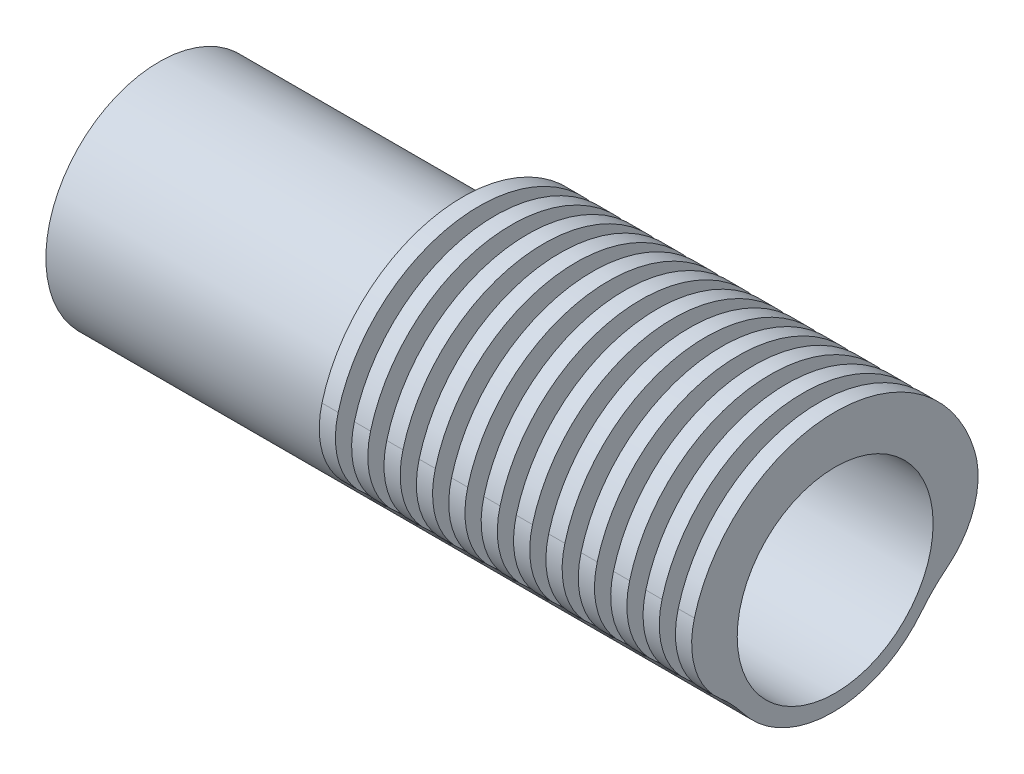
from build123d import *

# Parameters (mm, degrees)
SKETCH1_R           = 7
SKETCH1_R_2         = 4
BOSS_EXTRUDE1_DEPTH = 1.5
SKETCH2_R           = 7
SKETCH2_R_2         = 6.4
BOSS_EXTRUDE2_DEPTH = 40.1
BOSS_EXTRUDE5_REACH = 44.786
SKETCH12_R          = 6.4
SKETCH12_R_2        = 6.05
BOSS_EXTRUDE7_START = -1
BOSS_EXTRUDE7_DEPTH = 1
FILLET2_R           = 10
FILLET3_R           = 5
LPATTERN1_START     = 18.6
LPATTERN1_DEPTH     = 1
LPATTERN1_START_2   = 20.6
LPATTERN1_2_DEPTH   = 1
LPATTERN1_START_3   = 22.6
LPATTERN1_3_DEPTH   = 1
LPATTERN1_START_4   = 24.6
LPATTERN1_4_DEPTH   = 1
LPATTERN1_START_5   = 26.6
LPATTERN1_5_DEPTH   = 1
LPATTERN1_START_6   = 28.6
LPATTERN1_6_DEPTH   = 1
LPATTERN1_START_7   = 30.6
LPATTERN1_7_DEPTH   = 1
LPATTERN1_START_8   = 32.6
LPATTERN1_8_DEPTH   = 1
LPATTERN1_START_9   = 34.6
LPATTERN1_9_DEPTH   = 1
LPATTERN1_START_10  = 36.6
LPATTERN1_10_DEPTH  = 1
LPATTERN1_START_11  = 38.6
LPATTERN1_11_DEPTH  = 1
SKETCH15_R          = 7


# Read off the part's stored shape, not the designer's step: LPattern1
with BuildPart() as part:
    # Sketch1 → Boss-Extrude1 (new body)
    with BuildSketch(Plane(origin=(0, 0, 0), x_dir=(0, 0, -1), z_dir=(1, 0, 0))):
        with Locations((-0.15, 0)):
            Circle(SKETCH1_R)
        Circle(SKETCH1_R_2, mode=Mode.SUBTRACT)
    extrude(amount=BOSS_EXTRUDE1_DEPTH)

    # Sketch2 → Boss-Extrude2 (add)
    with BuildSketch(Plane(origin=(1.5, 0, 0), x_dir=(0, 0, -1), z_dir=(1, 0, 0))):
        with Locations((-0.15, 0)):
            Circle(SKETCH2_R)
        with Locations((-0.15, 0)):
            Circle(SKETCH2_R_2, mode=Mode.SUBTRACT)
    extrude(amount=BOSS_EXTRUDE2_DEPTH)

    # Sketch12 → Boss-Extrude5 (add, up to next)
    with BuildSketch(Plane(origin=(41.6, 0, 0), x_dir=(0, 0, -1), z_dir=(1, 0, 0)), mode=Mode.PRIVATE) as boss_extrude5_sk1:
        with Locations((-0.15, 0)):
            Circle(SKETCH12_R)
        Circle(SKETCH12_R_2, mode=Mode.SUBTRACT)
    boss_extrude5_tool1 = extrude(boss_extrude5_sk1.sketch, amount=-BOSS_EXTRUDE5_REACH, mode=Mode.PRIVATE) - part.part
    add(boss_extrude5_tool1.solids().sort_by_distance((41.6, 0, 6.368981))[0])

    # Sketch14 → Boss-Extrude7 (add)
    with BuildSketch(Plane(origin=(41.6, 0, 0), x_dir=(0, 0, -1), z_dir=(1, 0, 0)).offset(BOSS_EXTRUDE7_START)):
        with BuildLine():
            Line((-7.039083492, -1.241180339), (-8.863269777, -1.562833599))
            ThreePointArc((-8.863269777, -1.562833599), (0, 9), (8.863269777, -1.562833599))
            Line((8.863269777, -1.562833599), (6.748129599, -1.189877318))
            ThreePointArc((6.748129599, -1.189877318), (-0.176047227, 6.999951539), (-7.039083492, -1.241180339))
        make_face()
    extrude(amount=BOSS_EXTRUDE7_DEPTH)

    # Fillet2
    # the kernel refuses this fillet: 10 mm, written as the material it adds along each edge
    with BuildSketch(Plane(origin=(40.6, -1.189877318, -6.748129599), x_dir=(0, -0.9122124275498228, 0.409717569825434), z_dir=(1, 0, 0))) as fillet2_piece_1:
        with BuildLine():
            CenterArc((5.968676638, 9.685818843), FILLET2_R, 229.495547536, 26.104158306)
            Line((-0.526394739, 2.082263897), (-0.656296166, 1.930192799))
            ThreePointArc((-0.656296166, 1.930192799), (-0.457097485, 0.992114146), (-0.193900116, -0.049017803))
            Line((-0.193900116, -0.049017803), (0.049738972, -0.193716377))
            ThreePointArc((0.049738972, -0.193716377), (1.740864019, 0.01992681), (3.431989067, -0.193716377))
            Line((3.431989067, -0.193716377), (3.481728039, 0))
        make_face()
    extrude(amount=1)
    with BuildSketch(Plane(origin=(40.6, -1.241180339, 7.039083492), x_dir=(0, -0.9145376119425217, -0.4045008731047063), z_dir=(1, 0, 0))) as fillet2_piece_2:
        with BuildLine():
            CenterArc((5.662402917, -9.717692138), FILLET2_R, 103.646653122, 23.987142505)
            Line((-0.443720941, -1.798395993), (-0.565843418, -1.64001007))
            ThreePointArc((-0.565843418, -1.64001007), (-0.416037384, -0.851288435), (-0.194176914, 0.047909561))
            Line((-0.194176914, 0.047909561), (0.047186691, 0.194353843))
            ThreePointArc((0.047186691, 0.194353843), (1.651534184, 0.002384497), (3.255881677, 0.194353843))
            Line((3.255881677, 0.194353843), (3.303068368, 0))
        make_face()
    extrude(amount=1)

    # Fillet3
    fillet3_edges = [part.edges().sort_by_distance(p)[0] for p in [
        (41.1, -1.562833599, 8.863269777),
        (41.1, -1.562833599, -8.863269777),
    ]]
    fillet(fillet3_edges, radius=FILLET3_R)

    # LPattern1 outline → LPattern1 (add)
    with BuildSketch(Plane.YZ.offset(LPATTERN1_START)):
        with BuildLine():
            ThreePointArc((-2.762069023, -6.931785952), (-0.336916962, -8.599750686), (2.606424088, -8.614322578))
            ThreePointArc((2.606424088, -8.614322578), (8.998759062, 0.149450112), (2.31893468, 8.696122236))
            ThreePointArc((2.31893468, 8.696122236), (-0.448823677, 8.641049813), (-2.763066821, 7.121905987))
            ThreePointArc((-2.763066821, 7.121905987), (-3.475808056, 6.373673153), (-4.261960597, 5.702989453))
            ThreePointArc((-4.261960597, 5.702989453), (6.999688602, 0.083973644), (-4.365952904, -5.321604449))
            ThreePointArc((-4.365952904, -5.321604449), (-3.518119256, -6.080982981), (-2.762069023, -6.931785952))
        make_face()
    extrude(amount=LPATTERN1_DEPTH)

    # LPattern1 2 outline → LPattern1 2 (add)
    with BuildSketch(Plane.YZ.offset(LPATTERN1_START_2)):
        with BuildLine():
            ThreePointArc((-2.762069023, -6.931785952), (-0.336916962, -8.599750686), (2.606424088, -8.614322578))
            ThreePointArc((2.606424088, -8.614322578), (8.998759062, 0.149450112), (2.31893468, 8.696122236))
            ThreePointArc((2.31893468, 8.696122236), (-0.448823677, 8.641049813), (-2.763066821, 7.121905987))
            ThreePointArc((-2.763066821, 7.121905987), (-3.475808056, 6.373673153), (-4.261960597, 5.702989453))
            ThreePointArc((-4.261960597, 5.702989453), (6.999688602, 0.083973644), (-4.365952904, -5.321604449))
            ThreePointArc((-4.365952904, -5.321604449), (-3.518119256, -6.080982981), (-2.762069023, -6.931785952))
        make_face()
    extrude(amount=LPATTERN1_2_DEPTH)

    # LPattern1 3 outline → LPattern1 3 (add)
    with BuildSketch(Plane.YZ.offset(LPATTERN1_START_3)):
        with BuildLine():
            ThreePointArc((-2.762069023, -6.931785952), (-0.336916962, -8.599750686), (2.606424088, -8.614322578))
            ThreePointArc((2.606424088, -8.614322578), (8.998759062, 0.149450112), (2.31893468, 8.696122236))
            ThreePointArc((2.31893468, 8.696122236), (-0.448823677, 8.641049813), (-2.763066821, 7.121905987))
            ThreePointArc((-2.763066821, 7.121905987), (-3.475808056, 6.373673153), (-4.261960597, 5.702989453))
            ThreePointArc((-4.261960597, 5.702989453), (6.999688602, 0.083973644), (-4.365952904, -5.321604449))
            ThreePointArc((-4.365952904, -5.321604449), (-3.518119256, -6.080982981), (-2.762069023, -6.931785952))
        make_face()
    extrude(amount=LPATTERN1_3_DEPTH)

    # LPattern1 4 outline → LPattern1 4 (add)
    with BuildSketch(Plane.YZ.offset(LPATTERN1_START_4)):
        with BuildLine():
            ThreePointArc((-2.762069023, -6.931785952), (-0.336916962, -8.599750686), (2.606424088, -8.614322578))
            ThreePointArc((2.606424088, -8.614322578), (8.998759062, 0.149450112), (2.31893468, 8.696122236))
            ThreePointArc((2.31893468, 8.696122236), (-0.448823677, 8.641049813), (-2.763066821, 7.121905987))
            ThreePointArc((-2.763066821, 7.121905987), (-3.475808056, 6.373673153), (-4.261960597, 5.702989453))
            ThreePointArc((-4.261960597, 5.702989453), (6.999688602, 0.083973644), (-4.365952904, -5.321604449))
            ThreePointArc((-4.365952904, -5.321604449), (-3.518119256, -6.080982981), (-2.762069023, -6.931785952))
        make_face()
    extrude(amount=LPATTERN1_4_DEPTH)

    # LPattern1 5 outline → LPattern1 5 (add)
    with BuildSketch(Plane.YZ.offset(LPATTERN1_START_5)):
        with BuildLine():
            ThreePointArc((-2.762069023, -6.931785952), (-0.336916962, -8.599750686), (2.606424088, -8.614322578))
            ThreePointArc((2.606424088, -8.614322578), (8.998759062, 0.149450112), (2.31893468, 8.696122236))
            ThreePointArc((2.31893468, 8.696122236), (-0.448823677, 8.641049813), (-2.763066821, 7.121905987))
            ThreePointArc((-2.763066821, 7.121905987), (-3.475808056, 6.373673153), (-4.261960597, 5.702989453))
            ThreePointArc((-4.261960597, 5.702989453), (6.999688602, 0.083973644), (-4.365952904, -5.321604449))
            ThreePointArc((-4.365952904, -5.321604449), (-3.518119256, -6.080982981), (-2.762069023, -6.931785952))
        make_face()
    extrude(amount=LPATTERN1_5_DEPTH)

    # LPattern1 6 outline → LPattern1 6 (add)
    with BuildSketch(Plane.YZ.offset(LPATTERN1_START_6)):
        with BuildLine():
            ThreePointArc((-2.762069023, -6.931785952), (-0.336916962, -8.599750686), (2.606424088, -8.614322578))
            ThreePointArc((2.606424088, -8.614322578), (8.998759062, 0.149450112), (2.31893468, 8.696122236))
            ThreePointArc((2.31893468, 8.696122236), (-0.448823677, 8.641049813), (-2.763066821, 7.121905987))
            ThreePointArc((-2.763066821, 7.121905987), (-3.475808056, 6.373673153), (-4.261960597, 5.702989453))
            ThreePointArc((-4.261960597, 5.702989453), (6.999688602, 0.083973644), (-4.365952904, -5.321604449))
            ThreePointArc((-4.365952904, -5.321604449), (-3.518119256, -6.080982981), (-2.762069023, -6.931785952))
        make_face()
    extrude(amount=LPATTERN1_6_DEPTH)

    # LPattern1 7 outline → LPattern1 7 (add)
    with BuildSketch(Plane.YZ.offset(LPATTERN1_START_7)):
        with BuildLine():
            ThreePointArc((-2.762069023, -6.931785952), (-0.336916962, -8.599750686), (2.606424088, -8.614322578))
            ThreePointArc((2.606424088, -8.614322578), (8.998759062, 0.149450112), (2.31893468, 8.696122236))
            ThreePointArc((2.31893468, 8.696122236), (-0.448823677, 8.641049813), (-2.763066821, 7.121905987))
            ThreePointArc((-2.763066821, 7.121905987), (-3.475808056, 6.373673153), (-4.261960597, 5.702989453))
            ThreePointArc((-4.261960597, 5.702989453), (6.999688602, 0.083973644), (-4.365952904, -5.321604449))
            ThreePointArc((-4.365952904, -5.321604449), (-3.518119256, -6.080982981), (-2.762069023, -6.931785952))
        make_face()
    extrude(amount=LPATTERN1_7_DEPTH)

    # LPattern1 8 outline → LPattern1 8 (add)
    with BuildSketch(Plane.YZ.offset(LPATTERN1_START_8)):
        with BuildLine():
            ThreePointArc((-2.762069023, -6.931785952), (-0.336916962, -8.599750686), (2.606424088, -8.614322578))
            ThreePointArc((2.606424088, -8.614322578), (8.998759062, 0.149450112), (2.31893468, 8.696122236))
            ThreePointArc((2.31893468, 8.696122236), (-0.448823677, 8.641049813), (-2.763066821, 7.121905987))
            ThreePointArc((-2.763066821, 7.121905987), (-3.475808056, 6.373673153), (-4.261960597, 5.702989453))
            ThreePointArc((-4.261960597, 5.702989453), (6.999688602, 0.083973644), (-4.365952904, -5.321604449))
            ThreePointArc((-4.365952904, -5.321604449), (-3.518119256, -6.080982981), (-2.762069023, -6.931785952))
        make_face()
    extrude(amount=LPATTERN1_8_DEPTH)

    # LPattern1 9 outline → LPattern1 9 (add)
    with BuildSketch(Plane.YZ.offset(LPATTERN1_START_9)):
        with BuildLine():
            ThreePointArc((-2.762069023, -6.931785952), (-0.336916962, -8.599750686), (2.606424088, -8.614322578))
            ThreePointArc((2.606424088, -8.614322578), (8.998759062, 0.149450112), (2.31893468, 8.696122236))
            ThreePointArc((2.31893468, 8.696122236), (-0.448823677, 8.641049813), (-2.763066821, 7.121905987))
            ThreePointArc((-2.763066821, 7.121905987), (-3.475808056, 6.373673153), (-4.261960597, 5.702989453))
            ThreePointArc((-4.261960597, 5.702989453), (6.999688602, 0.083973644), (-4.365952904, -5.321604449))
            ThreePointArc((-4.365952904, -5.321604449), (-3.518119256, -6.080982981), (-2.762069023, -6.931785952))
        make_face()
    extrude(amount=LPATTERN1_9_DEPTH)

    # LPattern1 10 outline → LPattern1 10 (add)
    with BuildSketch(Plane.YZ.offset(LPATTERN1_START_10)):
        with BuildLine():
            ThreePointArc((-2.762069023, -6.931785952), (-0.336916962, -8.599750686), (2.606424088, -8.614322578))
            ThreePointArc((2.606424088, -8.614322578), (8.998759062, 0.149450112), (2.31893468, 8.696122236))
            ThreePointArc((2.31893468, 8.696122236), (-0.448823677, 8.641049813), (-2.763066821, 7.121905987))
            ThreePointArc((-2.763066821, 7.121905987), (-3.475808056, 6.373673153), (-4.261960597, 5.702989453))
            ThreePointArc((-4.261960597, 5.702989453), (6.999688602, 0.083973644), (-4.365952904, -5.321604449))
            ThreePointArc((-4.365952904, -5.321604449), (-3.518119256, -6.080982981), (-2.762069023, -6.931785952))
        make_face()
    extrude(amount=LPATTERN1_10_DEPTH)

    # LPattern1 11 outline → LPattern1 11 (add)
    with BuildSketch(Plane.YZ.offset(LPATTERN1_START_11)):
        with BuildLine():
            ThreePointArc((-2.762069023, -6.931785952), (-0.336916962, -8.599750686), (2.606424088, -8.614322578))
            ThreePointArc((2.606424088, -8.614322578), (8.998759062, 0.149450112), (2.31893468, 8.696122236))
            ThreePointArc((2.31893468, 8.696122236), (-0.448823677, 8.641049813), (-2.763066821, 7.121905987))
            ThreePointArc((-2.763066821, 7.121905987), (-3.475808056, 6.373673153), (-4.261960597, 5.702989453))
            ThreePointArc((-4.261960597, 5.702989453), (6.999688602, 0.083973644), (-4.365952904, -5.321604449))
            ThreePointArc((-4.365952904, -5.321604449), (-3.518119256, -6.080982981), (-2.762069023, -6.931785952))
        make_face()
    extrude(amount=LPATTERN1_11_DEPTH)


with BuildPart() as body_2:
    # Split1: the piece behind the surface
    add(part.part)
    # Sketch15 → Surface-Plane2: a flat surface bounded by the sketch
    with BuildSketch(Plane.ZY.offset(-18.6), mode=Mode.PRIVATE) as surface_plane2_1_region:
        with Locations(Location((0.15, 0, 0), (0, 0, 322.493493812))):
            Circle(SKETCH15_R)
    surface_plane2_1 = surface_plane2_1_region.sketch.faces()[0]
    split(bisect_by=surface_plane2_1, keep=Keep.BOTTOM)


with BuildPart() as part_1:
    add(part.part)

    # Split1: split by a surface, the side it looks to stays
    # Sketch15 → Surface-Plane2: a flat surface bounded by the sketch
    with BuildSketch(Plane.ZY.offset(-18.6), mode=Mode.PRIVATE) as surface_plane2_2_region:
        with Locations(Location((0.15, 0, 0), (0, 0, 322.493493812))):
            Circle(SKETCH15_R)
    surface_plane2_2 = surface_plane2_2_region.sketch.faces()[0]
    split(bisect_by=surface_plane2_2, keep=Keep.TOP)


solid = Compound([body_2.part, part_1.part])
